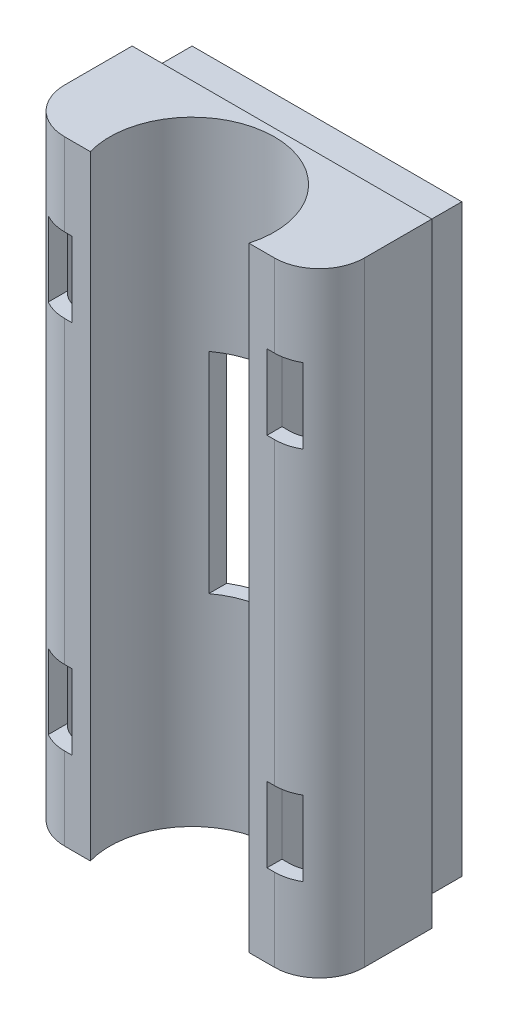
from build123d import *

# Parameters (mm, degrees)
BOSS_EXTRUDE1_DEPTH     = 82
CUT_EXTRUDE1_DEPTH      = 30
CUT_EXTRUDE1_DEPTH_BACK = 30
SKETCH2_W               = 6
SKETCH2_H               = 2
SHELL1_START            = 4
SHELL1_DEPTH            = 74
SHELL1_START_2          = 2
SHELL1_2_DEPTH          = 78
CUT_EXTRUDE2_DEPTH      = 6
CUT_EXTRUDE2_DEPTH_BACK = 6
SKETCH3_W               = 4
SKETCH3_H               = 10
SKETCH4_W               = 13.166010488
SKETCH4_H               = 28
CUT_EXTRUDE3_DEPTH      = 20


# Read off the part's stored shape, not the designer's step: Shell1
with BuildPart() as part:
    # Sketch1 → Boss-Extrude1 (new body)
    with BuildSketch(Plane(origin=(0, 0, 0), x_dir=(1, 0, 0), z_dir=(0, 1, 0))):
        with BuildLine():
            Line((-20, 12), (-20, 3))
            ThreePointArc((-20, 3), (-18.242640687, -1.242640687), (-14, -3))
            Line((-14, -3), (-10.583005244, -3))
            ThreePointArc((-10.583005244, -3), (0, 11), (10.583005244, -3))
            Line((10.583005244, -3), (14, -3))
            ThreePointArc((14, -3), (18.242640687, -1.242640687), (20, 3))
            Line((20, 3), (20, 12))
            Line((20, 12), (18, 12))
            Line((18, 12), (18, 18))
            Line((18, 18), (-18, 18))
            Line((-18, 18), (-18, 12))
            Line((-18, 12), (-20, 12))
        make_face()
    extrude(amount=BOSS_EXTRUDE1_DEPTH)

    # Sketch2 → Cut-Extrude1 (cut, two sides: drawn at the far end of the back side and taken through both)
    with BuildSketch(Plane(origin=(0, 0, 0), x_dir=(0, 0, -1), z_dir=(1, 0, 0)).offset(-CUT_EXTRUDE1_DEPTH_BACK)):
        with Locations((15, 81)):
            Rectangle(SKETCH2_W, SKETCH2_H)
        with Locations((15, 1)):
            Rectangle(SKETCH2_W, SKETCH2_H)
    extrude(amount=CUT_EXTRUDE1_DEPTH + CUT_EXTRUDE1_DEPTH_BACK, mode=Mode.SUBTRACT)

    # Shell1 outline → Shell1 (cut)
    with BuildSketch(Plane(origin=(0, 0, 0), x_dir=(1, 0, 0), z_dir=(0, 1, 0)).offset(SHELL1_START)):
        with BuildLine():
            Line((-14, -1), (-12.961481397, -1))
            ThreePointArc((-12.961481397, -1), (0, 13), (12.961481397, -1))
            Line((12.961481397, -1), (14, -1))
            ThreePointArc((14, -1), (16.828427125, 0.171572875), (18, 3))
            Line((18, 3), (18, 10))
            Line((18, 10), (16, 10))
            Line((16, 10), (16, 18))
            Line((16, 18), (-16, 18))
            Line((-16, 18), (-16, 10))
            Line((-16, 10), (-18, 10))
            Line((-18, 10), (-18, 3))
            ThreePointArc((-18, 3), (-16.828427125, 0.171572875), (-14, -1))
        make_face()
    extrude(amount=SHELL1_DEPTH, mode=Mode.SUBTRACT)

    # Shell1 2 outline → Shell1 2 (cut)
    with BuildSketch(Plane(origin=(0, 0, 0), x_dir=(1, 0, 0), z_dir=(0, 1, 0)).offset(SHELL1_START_2)):
        with BuildLine():
            Line((-14, -1), (-12.961481397, -1))
            ThreePointArc((-12.961481397, -1), (-11.972179223, 5.066253514), (-8.306623863, 10))
            Line((-8.306623863, 10), (-18, 10))
            Line((-18, 10), (-18, 3))
            ThreePointArc((-18, 3), (-16.828427125, 0.171572875), (-14, -1))
        make_face()
        with BuildLine():
            Line((18, 10), (8.306623863, 10))
            ThreePointArc((8.306623863, 10), (11.972179223, 5.066253514), (12.961481397, -1))
            Line((12.961481397, -1), (14, -1))
            ThreePointArc((14, -1), (16.828427125, 0.171572875), (18, 3))
            Line((18, 3), (18, 10))
        make_face()
    extrude(amount=SHELL1_2_DEPTH, mode=Mode.SUBTRACT)

    # Sketch3 → Cut-Extrude2 (cut, two sides: drawn at the far end of the back side and taken through both)
    with BuildSketch(Plane.XY.offset(-CUT_EXTRUDE2_DEPTH_BACK)):
        with Locations((-15, 16)):
            Rectangle(SKETCH3_W, SKETCH3_H)
        with Locations((15, 16)):
            Rectangle(SKETCH3_W, SKETCH3_H)
        with Locations((15, 66)):
            Rectangle(SKETCH3_W, SKETCH3_H)
        with Locations((-15, 66)):
            Rectangle(SKETCH3_W, SKETCH3_H)
    extrude(amount=CUT_EXTRUDE2_DEPTH + CUT_EXTRUDE2_DEPTH_BACK, mode=Mode.SUBTRACT)

    # Sketch4 → Cut-Extrude3 (cut)
    with BuildSketch(Plane.XY):
        with Locations((0, 41)):
            Rectangle(SKETCH4_W, SKETCH4_H)
    extrude(amount=-CUT_EXTRUDE3_DEPTH, mode=Mode.SUBTRACT)


solid = part.part
